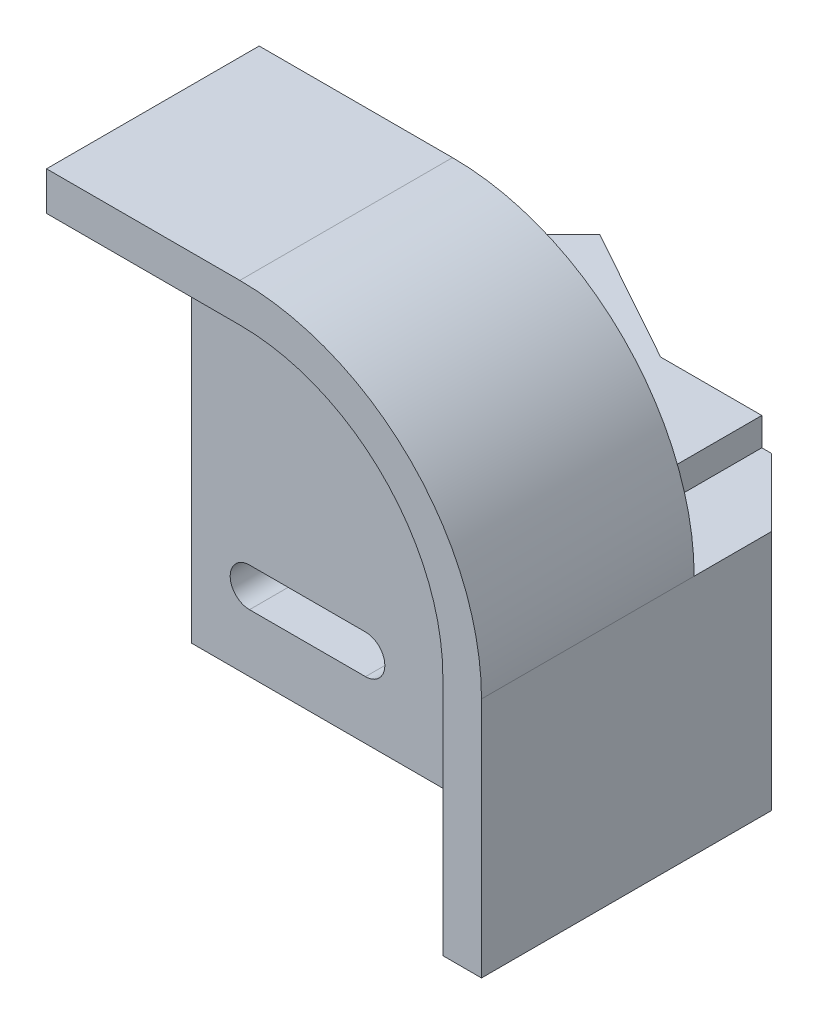
from build123d import *

# Parameters (mm, degrees)
BOSS_EXTRUDE1_DEPTH      = 7
EXTRUDE_THIN2_DEPTH      = 15
FILLET1_R                = 7
SKETCH5_W                = 15
SKETCH5_H                = 25
BOSS_EXTRUDE2_DEPTH      = 8
CUT_EXTRUDE2_DEPTH       = 42.641325627
LPATTERN1_COUNT          = 2
LPATTERN1_PITCH          = 26
CHAMFER3_SIZE            = 7
SKETCH9_W                = 15
SKETCH9_H                = 7
BOSS_EXTRUDE3_DEPTH      = 15
BOSS_EXTRUDE4_DEPTH      = 2
BOSS_EXTRUDE4_DEPTH_BACK = 9.9
SKETCH13_W               = 8
SKETCH13_H               = 2
BOSS_EXTRUDE6_DEPTH      = 6
CHAMFER6_SIZE            = 23.744712882
CHAMFER6_SIZE_2          = 13.5
CHAMFER7_SIZE            = 3
SKETCH14_R               = 1.5
CUT_EXTRUDE3_DEPTH       = 15
SKETCH15_W               = 15
SKETCH15_H               = 8.5
CUT_EXTRUDE4_DEPTH       = 6


with BuildPart() as part:
    # Sketch1 → Boss-Extrude1 (new body)
    with BuildSketch(Plane.XY):
        with BuildLine():
            Line((0, 25), (-20, 25))
            Line((-20, 25), (-20, -25))
            Line((-20, -25), (25, -25))
            Line((25, -25), (25, 0))
            ThreePointArc((25, 0), (17.67766953, 17.67766953), (0, 25))
        make_face()
    extrude(amount=BOSS_EXTRUDE1_DEPTH)

    # Sketch3 → Extrude-Thin2 (add)
    with BuildSketch(Plane.XY.offset(7)):
        with BuildLine():
            Line((25, -25), (25, 0))
            ThreePointArc((25, 0), (17.67766953, 17.67766953), (0, 25))
            Line((0, 25), (-20, 25))
            Line((-20, 25), (-20, 21))
            Line((-20, 21), (0, 21))
            ThreePointArc((0, 21), (14.849242405, 14.849242405), (21, 0))
            Line((21, 0), (21, -25))
            Line((21, -25), (25, -25))
        make_face()
    extrude(amount=EXTRUDE_THIN2_DEPTH)

    # Fillet1
    fillet1_edges = [part.edges().sort_by_distance(p)[0] for p in [
        (21, -12.5, 7),
        (14.849242405, 14.849242405, 7),
        (-10, 21, 7),
    ]]
    fillet(fillet1_edges, radius=FILLET1_R)

    # Sketch5 → Boss-Extrude2 (add)
    with BuildSketch(Plane(origin=(25, 0, 0), x_dir=(0, 0, -1), z_dir=(1, 0, 0))):
        with Locations((7.5, -12.5)):
            Rectangle(SKETCH5_W, SKETCH5_H)
    extrude(amount=-BOSS_EXTRUDE2_DEPTH)

    # Sketch8 → Cut-Extrude2 (cut, through all)
    with BuildSketch(Plane.XY.offset(7)):
        with BuildLine():
            Line((-14, -15), (-2, -15))
            ThreePointArc((-2, -15), (0, -17), (-2, -19))
            Line((-2, -19), (-14, -19))
            ThreePointArc((-14, -19), (-16, -17), (-14, -15))
        make_face()
    cut_extrude2 = extrude(amount=-CUT_EXTRUDE2_DEPTH, mode=Mode.SUBTRACT)

    # LPattern1: Cut-Extrude2 ×2
    with Locations(*[(0, i * LPATTERN1_PITCH, 0) for i in range(1, LPATTERN1_COUNT)]):
        add(cut_extrude2, mode=Mode.SUBTRACT)

    # Chamfer3
    chamfer3_edges = [part.edges().sort_by_distance(p)[0] for p in [
        (25, -12.5, -15),
    ]]
    chamfer(chamfer3_edges, length=CHAMFER3_SIZE)

    # Sketch9 → Boss-Extrude3 (add)
    with BuildSketch(Plane.ZY.offset(-17)):
        with Locations((-7.5, -3.5)):
            Rectangle(SKETCH9_W, SKETCH9_H)
    extrude(amount=BOSS_EXTRUDE3_DEPTH)

    # Sketch10 → Boss-Extrude4 (add, two sides: drawn at the far end of the back side and taken through both)
    with BuildSketch(Plane.XZ.offset(7).offset(-BOSS_EXTRUDE4_DEPTH_BACK)):
        Polygon((2, -15), (-6.970562748, -15), (-12.627416998, -9.343145751), (-16.870057685, -13.585786438), (-20, -10.455844123), (-20, 0), (17, 0), (17, -15), align=None)
        Polygon((-4.849242405, -10.050252532), (-9.091883092, -5.807611845), (-6.970562748, -3.686291501), (-2.727922061, -7.928932188), align=None, mode=Mode.SUBTRACT)
    extrude(amount=BOSS_EXTRUDE4_DEPTH + BOSS_EXTRUDE4_DEPTH_BACK)

    # Sketch13 → Boss-Extrude6 (add)
    with BuildSketch(Plane(origin=(-10.985281374, 0, -10.985281374), x_dir=(-0.7071067811865478, 0, 0.7071067811865472), z_dir=(-0.7071067811865472, 0, -0.7071067811865478))):
        with Locations((-1.67766953, 1.9)):
            Rectangle(SKETCH13_W, SKETCH13_H)
        with Locations((-1.67766953, -8)):
            Rectangle(SKETCH13_W, SKETCH13_H)
    extrude(amount=BOSS_EXTRUDE6_DEPTH)

    # Chamfer6
    # the kernel refuses this chamfer: 23.744712882, 13.5 mm, written as the material it adds along each edge
    with BuildSketch(Plane(origin=(-6.970562748, -9, -15), x_dir=(-0.7145740403020574, 0, -0.6995598194053126), z_dir=(0, 1, 0))) as chamfer6_piece_1_section:
        Polygon((CHAMFER6_SIZE * 0.999943641689, -CHAMFER6_SIZE * 0.0106166574102), (-CHAMFER6_SIZE_2 * 0.714574040302, -CHAMFER6_SIZE_2 * 0.699559819405), (0, 0), align=None)
    chamfer6_piece_1 = extrude(amount=2, mode=Mode.PRIVATE)
    chamfer6_piece_1 = split(chamfer6_piece_1, bisect_by=Plane(origin=(-9.095447466, -8, -21.360396657), z_dir=(0.7071067811865476, 0, 0.7071067811865476)), keep=Keep.TOP, mode=Mode.PRIVATE)
    add(chamfer6_piece_1)
    with BuildSketch(Plane(origin=(-6.970562748, -70.647744863, -15), x_dir=(-0.7145740403020574, 0, -0.6995598194053126), z_dir=(0, 1, 0))) as chamfer6_piece_2_section:
        Polygon((CHAMFER6_SIZE * 0.999943641689, -CHAMFER6_SIZE * 0.0106166574102), (-CHAMFER6_SIZE_2 * 0.714574040302, -CHAMFER6_SIZE_2 * 0.699559819405), (0, 0), align=None)
    chamfer6_piece_2 = extrude(amount=125.295489727, mode=Mode.PRIVATE)
    chamfer6_piece_2 = split(chamfer6_piece_2, bisect_by=Plane(origin=(-6.871868761, 2.9, -19.136817952), z_dir=(0, -1, 0)), keep=Keep.TOP, mode=Mode.PRIVATE)
    chamfer6_piece_2 = split(chamfer6_piece_2, bisect_by=Plane(origin=(-6.871868761, 0.9, -19.136817952), z_dir=(0, 1, 0)), keep=Keep.TOP, mode=Mode.PRIVATE)
    chamfer6_piece_2 = split(chamfer6_piece_2, bisect_by=Plane(origin=(-9.095447466, 1.9, -21.360396657), z_dir=(0.7071067811865476, 0, 0.7071067811865476)), keep=Keep.TOP, mode=Mode.PRIVATE)
    add(chamfer6_piece_2)
    with BuildSketch(Plane(origin=(-6.970562748, -60.747744863, -15), x_dir=(-0.7145740403020574, 0, -0.6995598194053126), z_dir=(0, 1, 0))) as chamfer6_piece_3_section:
        Polygon((CHAMFER6_SIZE * 0.999943641689, -CHAMFER6_SIZE * 0.0106166574102), (-CHAMFER6_SIZE_2 * 0.714574040302, -CHAMFER6_SIZE_2 * 0.699559819405), (0, 0), align=None)
    chamfer6_piece_3 = extrude(amount=125.295489727, mode=Mode.PRIVATE)
    chamfer6_piece_3 = split(chamfer6_piece_3, bisect_by=Plane(origin=(-6.871868761, -7, -19.136817952), z_dir=(0, -1, 0)), keep=Keep.TOP, mode=Mode.PRIVATE)
    chamfer6_piece_3 = split(chamfer6_piece_3, bisect_by=Plane(origin=(-9.095447466, -8, -21.360396657), z_dir=(0.7071067811865476, 0, 0.7071067811865476)), keep=Keep.TOP, mode=Mode.PRIVATE)
    chamfer6_piece_3 = split(chamfer6_piece_3, bisect_by=Plane(origin=(-6.871868761, -9, -19.136817952), z_dir=(0, 1, 0)), keep=Keep.TOP, mode=Mode.PRIVATE)
    add(chamfer6_piece_3)
    with BuildSketch(Plane(origin=(-6.970562748, 0.9, -15), x_dir=(-0.7145740403020574, 0, -0.6995598194053126), z_dir=(0, 1, 0))) as chamfer6_piece_4_section:
        Polygon((CHAMFER6_SIZE * 0.999943641689, -CHAMFER6_SIZE * 0.0106166574102), (-CHAMFER6_SIZE_2 * 0.714574040302, -CHAMFER6_SIZE_2 * 0.699559819405), (0, 0), align=None)
    chamfer6_piece_4 = extrude(amount=2, mode=Mode.PRIVATE)
    chamfer6_piece_4 = split(chamfer6_piece_4, bisect_by=Plane(origin=(-9.095447466, 1.9, -21.360396657), z_dir=(0.7071067811865476, 0, 0.7071067811865476)), keep=Keep.TOP, mode=Mode.PRIVATE)
    add(chamfer6_piece_4)

    # Chamfer7
    chamfer7_edges = [part.edges().sort_by_distance(p)[0] for p in [
        (-1.5, 2.9, 0),
        (17, -9, -7.5),
        (17, -17, 0),
        (-1.5, -9, 0),
    ]]
    chamfer(chamfer7_edges, length=CHAMFER7_SIZE)

    # Sketch14 → Cut-Extrude3 (cut)
    with BuildSketch(Plane(origin=(-10.985281374, 0, -10.985281374), x_dir=(-0.7071067811865478, 0, 0.7071067811865472), z_dir=(-0.7071067811865472, 0, -0.7071067811865478))):
        with Locations((-0.67766953, -3.05)):
            Circle(SKETCH14_R)
    extrude(amount=-CUT_EXTRUDE3_DEPTH, mode=Mode.SUBTRACT)

    # Sketch15 → Cut-Extrude4 (cut)
    with BuildSketch(Plane(origin=(-15.227922061, 0, -15.227922061), x_dir=(-0.7071067811865475, 0, 0.7071067811865477), z_dir=(-0.7071067811865477, 0, -0.7071067811865475))):
        with Locations((-4.87766953, -3.05)):
            Rectangle(SKETCH15_W, SKETCH15_H)
    extrude(amount=-CUT_EXTRUDE4_DEPTH, mode=Mode.SUBTRACT)


solid = part.part
